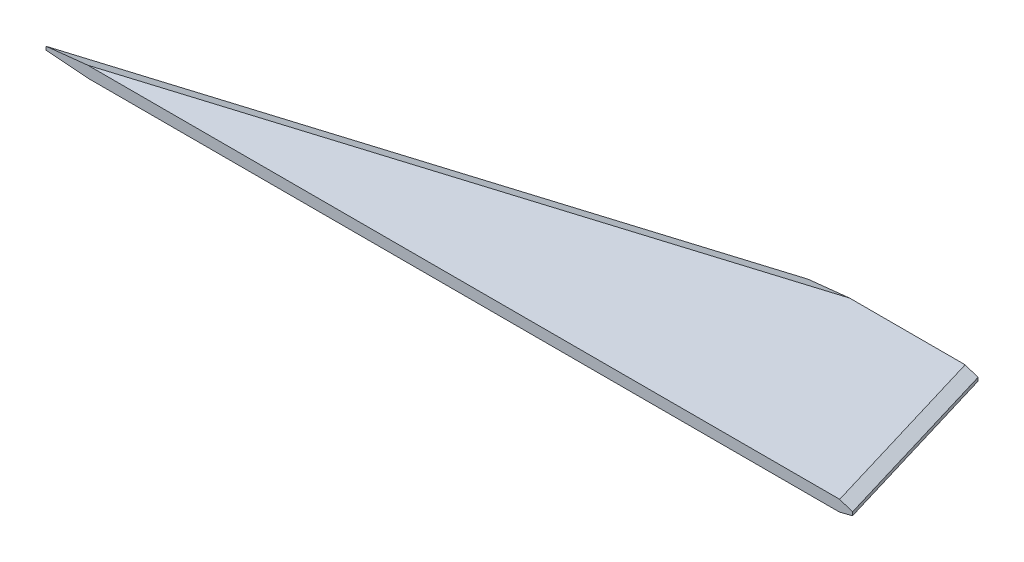
from build123d import *
from OCP.BRepFilletAPI import BRepFilletAPI_MakeChamfer

# Parameters (mm, degrees)
BOSS_EXTRUDE1_DEPTH = 3.175
CHAMFER1_SIZE       = 1.27
CHAMFER1_SIZE2      = 3.489296323
CHAMFER2_SIZE       = 3.556
CHAMFER2_SIZE2      = 0.952827328


with BuildPart() as part:
    # Sketch1 → Boss-Extrude1 (new body)
    with BuildSketch(Plane(origin=(0, 0, 0), x_dir=(1, 0, 0), z_dir=(0, 1, 0))):
        Polygon((0, 0), (228.6, 0), (213.36, 50.8), (165.1, 50.8), align=None)
    extrude(amount=BOSS_EXTRUDE1_DEPTH)

    # Chamfer1: one chamfer whose edges measure the first distance from different faces: ONE call of the kernel's chamfer builder (chamfer() names one face for all edges)
    chamfer1_edges_1 = [part.edges().sort_by_distance(p)[0] for p in [
        (82.55, 3.175, -25.4),
    ]]
    chamfer1_side_1 = [part.faces().sort_by_distance(p)[0] for p in [
        (82.55, 1.5875, -25.4),
    ]]
    chamfer1_edges_2 = [part.edges().sort_by_distance(p)[0] for p in [
        (220.98, 3.175, -25.4),
    ]]
    chamfer1_side_2 = [part.faces().sort_by_distance(p)[0] for p in [
        (220.98, 1.5875, -25.4),
    ]]
    chamfer1 = BRepFilletAPI_MakeChamfer(part.part.solid().wrapped)
    for e in chamfer1_edges_1:
        chamfer1.Add(CHAMFER1_SIZE, CHAMFER1_SIZE2, e.wrapped, chamfer1_side_1[0].wrapped)  # the first distance lies on this face
    for e in chamfer1_edges_2:
        chamfer1.Add(CHAMFER1_SIZE, CHAMFER1_SIZE2, e.wrapped, chamfer1_side_2[0].wrapped)  # the first distance lies on this face
    add(Compound.cast(chamfer1.Shape()), mode=Mode.REPLACE)

    # Chamfer2
    chamfer2_edges = [part.edges().sort_by_distance(p)[0] for p in [
        (220.98, 0, -25.4),
        (82.55, 0, -25.4),
    ]]
    chamfer2_side = [part.faces().sort_by_distance(p)[0] for p in [
        (143.630397554, 0, -19.885015291),
    ]]
    chamfer(chamfer2_edges, length=CHAMFER2_SIZE, length2=CHAMFER2_SIZE2, reference=chamfer2_side[0])


solid = part.part
